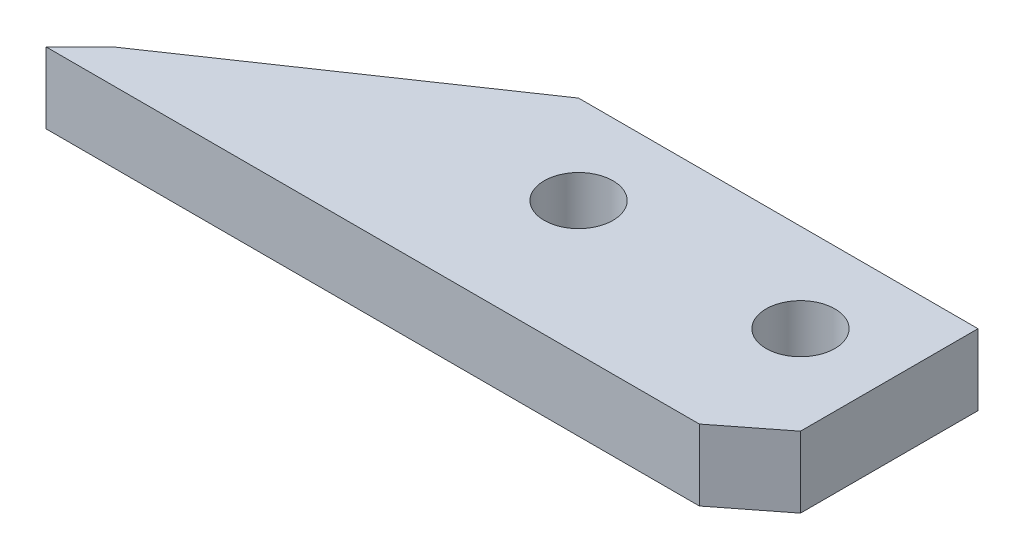
from build123d import *

# Parameters (mm, degrees)
SKETCH1_R           = 3.1
BOSS_EXTRUDE1_DEPTH = 6.4


with BuildPart() as part:
    # Sketch1 → Boss-Extrude1 (new body)
    with BuildSketch(Plane(origin=(0, 0, 0), x_dir=(1, 0, 0), z_dir=(0, 1, 0))):
        Polygon((0, 0), (-25, -17), (-28, -20), (-10.360225132, -20), (30.881282251, -20), (36, -16), (36, 0), align=None)
        with Locations((28, -8)):
            Circle(SKETCH1_R, mode=Mode.SUBTRACT)
        with Locations((8, -8)):
            Circle(SKETCH1_R, mode=Mode.SUBTRACT)
    extrude(amount=BOSS_EXTRUDE1_DEPTH)


solid = part.part
